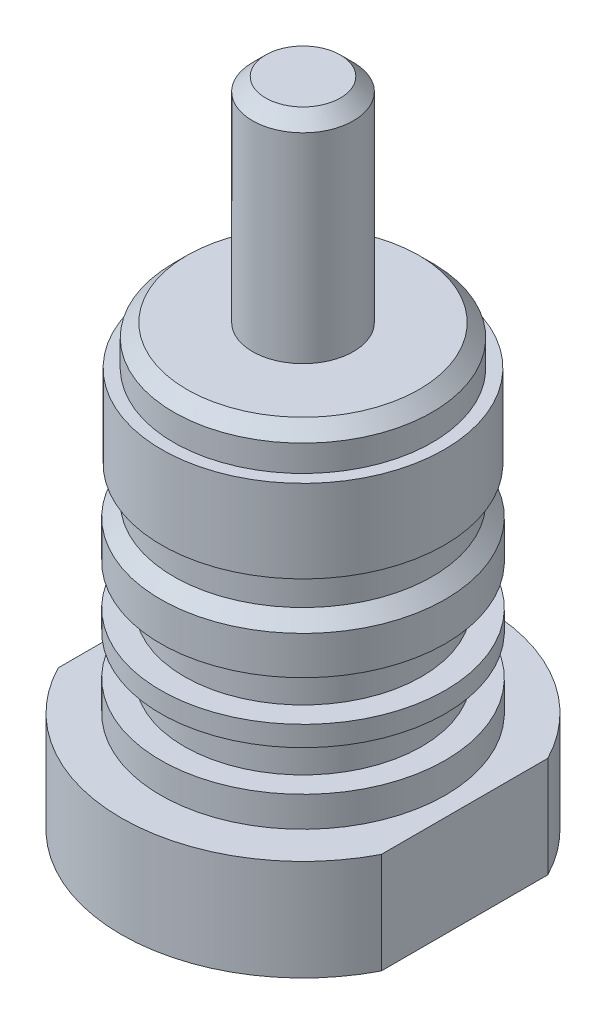
from build123d import *

# Parameters (mm, degrees)
ENL_V_MAT_EXTRU_1_DEPTH = 35.71728676
CHANFREIN1_SIZE         = 0.65


with BuildPart() as part:
    # Esquisse1 → Révolution1 (revolve)
    with BuildSketch(Plane.XY):
        Polygon((0, -21.75), (-9, -21.75), (-9, -16.75), (-7.05, -16.75), (-7.05, -15.25), (-5.875, -15.25), (-5.875, -13.25), (-7.05, -13.25), (-7.05, -12.25), (-5.875, -12.25), (-5.875, -10.25), (-7.05, -10.25), (-7.05, -7.7), (-6.4, -7.7), (-6.4, -6.05), (-7, -6.05), (-7, -1.95), (-6.4, -1.95), (-6.4, 0), (-2.5, 0), (-2.5, 10.55), (0, 10.55), (0, 0), align=None)
    revolve(axis=Axis((0, 0, 0), (0, -1, 0)))

    # Esquisse2 → Enlèv. mat.-Extru.1 (cut, through all)
    with BuildSketch(Plane.XZ.offset(21.75)):
        with BuildLine():
            Line((8, 4.123105626), (8, -4.123105626))
            ThreePointArc((8, -4.123105626), (9, 0), (8, 4.123105626))
        make_face()
        with BuildLine():
            Line((-8, 4.123105626), (-8, -4.123105626))
            ThreePointArc((-8, -4.123105626), (-9, 0), (-8, 4.123105626))
        make_face()
    extrude(amount=-ENL_V_MAT_EXTRU_1_DEPTH, mode=Mode.SUBTRACT)

    # Chanfrein1
    chanfrein1_edges = [part.edges().sort_by_distance(p)[0] for p in [
        (2.5, 10.55, 0),
        (6.4, 0, 0),
        (7.05, -7.7, 0),
    ]]
    chamfer(chanfrein1_edges, length=CHANFREIN1_SIZE - 0.0001)  # a hair under: the kernel refuses the full size


solid = part.part
